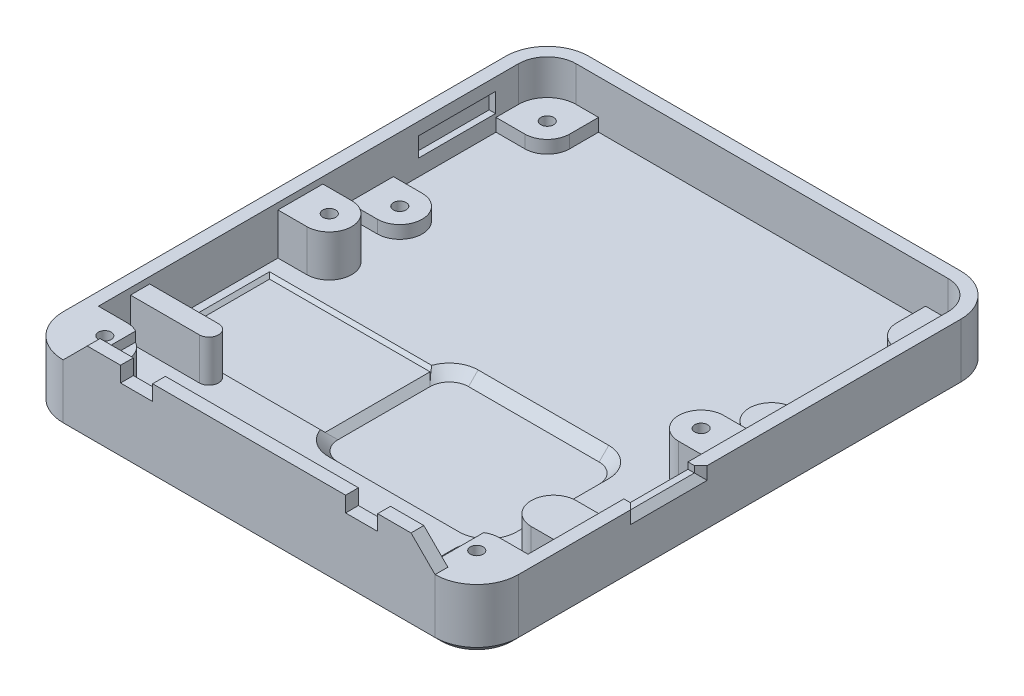
from build123d import *

# Parameters (mm, degrees)
BOSS_EXTRUDE1_DEPTH          = 9.5
BOSS_EXTRUDE2_DEPTH          = 2
CUT_EXTRUDE2_DEPTH           = 1.5
CHAMFER1_SIZE                = 1.5
BOSS_EXTRUDE3_DEPTH          = 8
BOSS_EXTRUDE4_DEPTH          = 3.5
BOSS_EXTRUDE5_START          = -2
BOSS_EXTRUDE5_DEPTH          = 2
BOSS_EXTRUDE6_DEPTH          = 7.5
CUT_EXTRUDE3_REACH           = 85.273
SKETCH11_W                   = 10
SKETCH11_H                   = 1.000174578
CHAMFER2_SIZE                = 1
CHAMFER4_SIZE                = 1
F_2_0_2_DIAMETER_HOLE1_D     = 2
F_2_0_2_DIAMETER_HOLE2_D     = 2
F_2_0_2_DIAMETER_HOLE3_D     = 2
F_2_0_2_DIAMETER_HOLE4_D     = 2
F_2_0_2_DIAMETER_HOLE5_D     = 2
F_2_0_2_DIAMETER_HOLE5_DEPTH = 6.5
F_2_0_2_DIAMETER_HOLE6_D     = 2
F_2_0_2_DIAMETER_HOLE6_DEPTH = 6.5
F_2_0_2_DIAMETER_HOLE7_D     = 2
F_2_0_2_DIAMETER_HOLE7_DEPTH = 3
F_2_0_2_DIAMETER_HOLE8_D     = 2
F_2_0_2_DIAMETER_HOLE8_DEPTH = 3
SKETCH34_W                   = 26.314778403
SKETCH34_H                   = 14.364291853
CUT_EXTRUDE5_DEPTH           = 0.5
CHAMFER5_SIZE                = 1.5
SKETCH12_W                   = 12
SKETCH12_H                   = 3
CUT_EXTRUDE6_DEPTH           = 1
SKETCH35_W                   = 54.374424004
SKETCH35_H                   = 8.57873693
CUT_EXTRUDE7_DEPTH           = 1.5
CUT_EXTRUDE8_DEPTH           = 0.4
CUT_EXTRUDE14_DEPTH          = 0.4


# Some blends are built 0.0001 mm under size
with BuildPart() as part:
    # Sketch2 → Boss-Extrude1 (new body)
    with BuildSketch(Plane(origin=(0, 0, 0), x_dir=(1, 0, 0), z_dir=(0, 1, 0))):
        with BuildLine():
            Line((-30.346153846, 41.446848386), (27.653846154, 41.446848386))
            ThreePointArc((27.653846154, 41.446848386), (32.250040232, 39.543042463), (34.153846154, 34.946848386))
            Line((34.153846154, 34.946848386), (34.153846154, -34.053151614))
            ThreePointArc((34.153846154, -34.053151614), (32.250040232, -38.649345692), (27.653846154, -40.553151614))
            Line((27.653846154, -40.553151614), (-30.346153846, -40.553151614))
            ThreePointArc((-30.346153846, -40.553151614), (-34.942347924, -38.649345692), (-36.846153846, -34.053151614))
            Line((-36.846153846, -34.053151614), (-36.846153846, 34.946848386))
            ThreePointArc((-36.846153846, 34.946848386), (-34.942347924, 39.543042463), (-30.346153846, 41.446848386))
        make_face()
        with BuildLine():
            Line((-30.346153846, 39.446848386), (27.653846154, 39.446848386))
            ThreePointArc((27.653846154, 39.446848386), (30.835826669, 38.128828901), (32.153846154, 34.946848386))
            Line((32.153846154, 34.946848386), (32.153846154, -34.053151614))
            ThreePointArc((32.153846154, -34.053151614), (30.835826669, -37.23513213), (27.653846154, -38.553151614))
            Line((27.653846154, -38.553151614), (-30.346153846, -38.553151614))
            ThreePointArc((-30.346153846, -38.553151614), (-33.528134361, -37.23513213), (-34.846153846, -34.053151614))
            Line((-34.846153846, -34.053151614), (-34.846153846, 34.946848386))
            ThreePointArc((-34.846153846, 34.946848386), (-33.528134361, 38.128828901), (-30.346153846, 39.446848386))
        make_face(mode=Mode.SUBTRACT)
    extrude(amount=BOSS_EXTRUDE1_DEPTH)

    # Sketch3 → Boss-Extrude2 (add)
    with BuildSketch(Plane(origin=(0, 0, 0), x_dir=(1, 0, 0), z_dir=(0, 1, 0))):
        with BuildLine():
            Line((-30.346153846, -38.553151614), (27.653846154, -38.553151614))
            ThreePointArc((27.653846154, -38.553151614), (30.835826669, -37.23513213), (32.153846154, -34.053151614))
            Line((32.153846154, -34.053151614), (32.153846154, 34.946848386))
            ThreePointArc((32.153846154, 34.946848386), (30.835826669, 38.128828901), (27.653846154, 39.446848386))
            Line((27.653846154, 39.446848386), (-30.346153846, 39.446848386))
            ThreePointArc((-30.346153846, 39.446848386), (-33.528134361, 38.128828901), (-34.846153846, 34.946848386))
            Line((-34.846153846, 34.946848386), (-34.846153846, -34.053151614))
            ThreePointArc((-34.846153846, -34.053151614), (-33.528134361, -37.23513213), (-30.346153846, -38.553151614))
        make_face()
    extrude(amount=BOSS_EXTRUDE2_DEPTH)

    # Sketch4 → Cut-Extrude2 (cut)
    with BuildSketch(Plane(origin=(0, 2, 0), x_dir=(1, 0, 0), z_dir=(0, 1, 0))):
        with BuildLine():
            Line((-4.123389118, -3.554786526), (16.244427307, -3.554786526))
            ThreePointArc((16.244427307, -3.554786526), (18.365747651, -4.433466182), (19.244427307, -6.554786526))
            Line((19.244427307, -6.554786526), (19.244427307, -20.919078379))
            ThreePointArc((19.244427307, -20.919078379), (18.365747651, -23.040398722), (16.244427307, -23.919078379))
            Line((16.244427307, -23.919078379), (-4.123389118, -23.919078379))
            ThreePointArc((-4.123389118, -23.919078379), (-6.244709462, -23.040398722), (-7.123389118, -20.919078379))
            Line((-7.123389118, -20.919078379), (-7.123389118, -6.554786526))
            ThreePointArc((-7.123389118, -6.554786526), (-6.244709462, -4.433466182), (-4.123389118, -3.554786526))
        make_face()
    extrude(amount=-CUT_EXTRUDE2_DEPTH, mode=Mode.SUBTRACT)

    # Chamfer1
    chamfer1_edges = [part.edges().sort_by_distance(p)[0] for p in [
        (6.060519095, 2, 23.919078379),
        (18.365747651, 2, 23.040398722),
        (-6.244709462, 2, 23.040398722),
        (19.244427307, 2, 13.736932452),
        (-7.123389118, 2, 13.736932452),
        (18.365747651, 2, 4.433466182),
        (-6.244709462, 2, 4.433466182),
        (6.060519095, 2, 3.554786526),
    ]]
    chamfer(chamfer1_edges, length=CHAMFER1_SIZE - 0.0001)  # a hair under: the kernel refuses the full size

    # Sketch5 → Boss-Extrude3 (add)
    with BuildSketch(Plane(origin=(0, 0.5, 0), x_dir=(1, 0, 0), z_dir=(0, 1, 0))):
        with BuildLine():
            Line((-30.346153846, 4.446848386), (-34.846153846, 4.446848386))
            Line((-34.846153846, 4.446848386), (-34.846153846, -2.553151614))
            Line((-34.846153846, -2.553151614), (-30.346153846, -2.553151614))
            ThreePointArc((-30.346153846, -2.553151614), (-26.846153846, 0.946848386), (-30.346153846, 4.446848386))
        make_face()
        with BuildLine():
            Line((27.653846154, 4.446848386), (32.153846154, 4.446848386))
            Line((32.153846154, 4.446848386), (32.153846154, -2.553151614))
            Line((32.153846154, -2.553151614), (27.653846154, -2.553151614))
            ThreePointArc((27.653846154, -2.553151614), (24.153846154, 0.946848386), (27.653846154, 4.446848386))
        make_face()
        with BuildLine():
            Line((32.153846154, -18.553151614), (32.153846154, -25.553151614))
            Line((32.153846154, -25.553151614), (27.653846154, -25.553151614))
            ThreePointArc((27.653846154, -25.553151614), (24.153846154, -22.053151614), (27.653846154, -18.553151614))
            Line((27.653846154, -18.553151614), (32.153846154, -18.553151614))
        make_face()
        with BuildLine():
            Line((-34.846153846, -25.553151614), (-24.109430948, -25.553151614))
            ThreePointArc((-24.109430948, -25.553151614), (-22.609430948, -24.053151614), (-24.109430948, -22.553151614))
            Line((-24.109430948, -22.553151614), (-34.846153846, -22.553151614))
            Line((-34.846153846, -22.553151614), (-34.846153846, -25.553151614))
        make_face()
    extrude(amount=BOSS_EXTRUDE3_DEPTH)

    # Sketch6 → Boss-Extrude4 (add)
    with BuildSketch(Plane(origin=(0, 0.5, 0), x_dir=(1, 0, 0), z_dir=(0, 1, 0))):
        with BuildLine():
            Line((-30.346153846, 15.446848386), (-34.846153846, 15.446848386))
            Line((-34.846153846, 15.446848386), (-34.846153846, 8.446848386))
            Line((-34.846153846, 8.446848386), (-30.346153846, 8.446848386))
            ThreePointArc((-30.346153846, 8.446848386), (-26.846153846, 11.946848386), (-30.346153846, 15.446848386))
        make_face()
        with BuildLine():
            Line((-26.846153846, 34.946848386), (-26.846153846, 39.446848386))
            Line((-26.846153846, 39.446848386), (-30.346153846, 39.446848386))
            ThreePointArc((-30.346153846, 39.446848386), (-33.528134361, 38.128828901), (-34.846153846, 34.946848386))
            Line((-34.846153846, 34.946848386), (-34.846153846, 31.446848386))
            Line((-34.846153846, 31.446848386), (-30.346153846, 31.446848386))
            ThreePointArc((-30.346153846, 31.446848386), (-27.871280112, 32.471974652), (-26.846153846, 34.946848386))
        make_face()
        with BuildLine():
            Line((24.153846154, 34.946848386), (24.153846154, 39.446848386))
            Line((24.153846154, 39.446848386), (27.653846154, 39.446848386))
            ThreePointArc((27.653846154, 39.446848386), (30.835826669, 38.128828901), (32.153846154, 34.946848386))
            Line((32.153846154, 34.946848386), (32.153846154, 31.446848386))
            Line((32.153846154, 31.446848386), (27.653846154, 31.446848386))
            ThreePointArc((27.653846154, 31.446848386), (25.17897242, 32.471974652), (24.153846154, 34.946848386))
        make_face()
        with BuildLine():
            Line((27.653846154, 15.446848386), (32.153846154, 15.446848386))
            Line((32.153846154, 15.446848386), (32.153846154, 8.446848386))
            Line((32.153846154, 8.446848386), (27.653846154, 8.446848386))
            ThreePointArc((27.653846154, 8.446848386), (24.153846154, 11.946848386), (27.653846154, 15.446848386))
        make_face()
    extrude(amount=BOSS_EXTRUDE4_DEPTH)

    # Sketch7 → Boss-Extrude5 (add)
    with BuildSketch(Plane.XY.offset(40.553151614).offset(BOSS_EXTRUDE5_START)):
        Polygon((27.653846154, 9.5), (-30.346153846, 9.5), (-26.595001855, 13.251151991), (-21.39693017, 13.251151991), (-21.39693017, 10.851151991), (-16.39693017, 10.851151991), (-16.39693017, 13.251151991), (13.704622477, 13.251151991), (13.704622477, 10.851151991), (18.704622477, 10.851151991), (18.704622477, 13.251151991), (23.902694163, 13.251151991), align=None)
    extrude(amount=BOSS_EXTRUDE5_DEPTH)

    # Sketch10 → Boss-Extrude6 (add)
    with BuildSketch(Plane(origin=(0, 2, 0), x_dir=(1, 0, 0), z_dir=(0, 1, 0))):
        with BuildLine():
            Line((-30.346153846, -30.553151614), (-34.846153846, -30.553151614))
            Line((-34.846153846, -30.553151614), (-34.846153846, -34.053151614))
            ThreePointArc((-34.846153846, -34.053151614), (-33.528134361, -37.23513213), (-30.346153846, -38.553151614))
            Line((-30.346153846, -38.553151614), (-26.846153846, -38.553151614))
            Line((-26.846153846, -38.553151614), (-26.846153846, -34.053151614))
            ThreePointArc((-26.846153846, -34.053151614), (-27.871280112, -31.57827788), (-30.346153846, -30.553151614))
        make_face()
        with BuildLine():
            Line((27.653846154, -30.553151614), (32.153846154, -30.553151614))
            Line((32.153846154, -30.553151614), (32.153846154, -34.053151614))
            ThreePointArc((32.153846154, -34.053151614), (30.835826669, -37.23513213), (27.653846154, -38.553151614))
            Line((27.653846154, -38.553151614), (24.153846154, -38.553151614))
            Line((24.153846154, -38.553151614), (24.153846154, -34.053151614))
            ThreePointArc((24.153846154, -34.053151614), (25.17897242, -31.57827788), (27.653846154, -30.553151614))
        make_face()
    extrude(amount=BOSS_EXTRUDE6_DEPTH)

    # Sketch11 → Cut-Extrude3 (cut, up to next)
    with BuildSketch(Plane(origin=(34.153846154, 0, 0), x_dir=(0, 0, -1), z_dir=(1, 0, 0)), mode=Mode.PRIVATE) as cut_extrude3_sk1:
        with Locations((-10.60615222, 9.00123928)):
            Rectangle(SKETCH11_W, SKETCH11_H)
    cut_extrude3_tool1 = extrude(cut_extrude3_sk1.sketch, amount=-CUT_EXTRUDE3_REACH, mode=Mode.PRIVATE) & part.part
    add(cut_extrude3_tool1.solids().sort_by_distance((34.153846, 9.001239, 10.606152))[0], mode=Mode.SUBTRACT)

    # Chamfer2
    chamfer2_edges = [part.edges().sort_by_distance(p)[0] for p in [
        (34.153846154, 9.000575996, 15.60615222),
        (34.153846154, 8.501151991, 10.60615222),
        (34.153846154, 9.000575996, 5.60615222),
    ]]
    chamfer(chamfer2_edges, length=CHAMFER2_SIZE)

    # Chamfer4
    chamfer4_edges = [part.edges().sort_by_distance(p)[0] for p in [
        (-36.846153846, 0, -0.446848386),
        (-34.942347924, 0, -39.543042463),
        (-1.346153846, 0, -41.446848386),
        (32.250040232, 0, -39.543042463),
        (34.153846154, 0, -0.446848386),
        (32.250040232, 0, 38.649345692),
        (-1.346153846, 0, 40.553151614),
        (-34.942347924, 0, 38.649345692),
    ]]
    chamfer(chamfer4_edges, length=CHAMFER4_SIZE)

    # Ø2.0 (2) Diameter Hole1 (through all)
    with Locations(Plane(origin=(0, 0, 0), x_dir=(-1, 0, 0), z_dir=(0, -1, 0))):
        with Locations((30.346153846, -34.053151614)):
            Hole(F_2_0_2_DIAMETER_HOLE1_D / 2)

    # Ø2.0 (2) Diameter Hole2 (through all)
    with Locations(Plane(origin=(0, 0, 0), x_dir=(-1, 0, 0), z_dir=(0, -1, 0))):
        with Locations((-27.653846154, -34.053151614)):
            Hole(F_2_0_2_DIAMETER_HOLE2_D / 2)

    # Ø2.0 (2) Diameter Hole3 (through all)
    with Locations(Plane(origin=(0, 0, 0), x_dir=(-1, 0, 0), z_dir=(0, -1, 0))):
        with Locations((30.346153846, 34.946848386)):
            Hole(F_2_0_2_DIAMETER_HOLE3_D / 2)

    # Ø2.0 (2) Diameter Hole4 (through all)
    with Locations(Plane(origin=(0, 0, 0), x_dir=(-1, 0, 0), z_dir=(0, -1, 0))):
        with Locations((-27.653846154, 34.946848386)):
            Hole(F_2_0_2_DIAMETER_HOLE4_D / 2)

    # Ø2.0 (2) Diameter Hole5
    with Locations(Plane(origin=(0, 8.5, 0), x_dir=(1, 0, 0), z_dir=(0, 1, 0))):
        with Locations((-30.346153846, 0.946848386)):
            Hole(F_2_0_2_DIAMETER_HOLE5_D / 2, depth=F_2_0_2_DIAMETER_HOLE5_DEPTH)

    # Ø2.0 (2) Diameter Hole6
    with Locations(Plane(origin=(0, 8.5, 0), x_dir=(1, 0, 0), z_dir=(0, 1, 0))):
        with Locations((27.653846154, 0.946848386)):
            Hole(F_2_0_2_DIAMETER_HOLE6_D / 2, depth=F_2_0_2_DIAMETER_HOLE6_DEPTH)

    # Ø2.0 (2) Diameter Hole7
    with Locations(Plane(origin=(0, 4, 0), x_dir=(1, 0, 0), z_dir=(0, 1, 0))):
        with Locations((-30.346153846, 11.946848386)):
            Hole(F_2_0_2_DIAMETER_HOLE7_D / 2, depth=F_2_0_2_DIAMETER_HOLE7_DEPTH)

    # Ø2.0 (2) Diameter Hole8
    with Locations(Plane(origin=(0, 4, 0), x_dir=(1, 0, 0), z_dir=(0, 1, 0))):
        with Locations((27.653846154, 11.946848386)):
            Hole(F_2_0_2_DIAMETER_HOLE8_D / 2, depth=F_2_0_2_DIAMETER_HOLE8_DEPTH)

    # Sketch34 → Cut-Extrude5 (cut)
    with BuildSketch(Plane(origin=(0, 2, 0), x_dir=(1, 0, 0), z_dir=(0, 1, 0))):
        with Locations((-19.000372269, -13.736932453)):
            Rectangle(SKETCH34_W, SKETCH34_H)
    extrude(amount=-CUT_EXTRUDE5_DEPTH, mode=Mode.SUBTRACT)

    # Chamfer5
    # the kernel refuses this chamfer: 1.5 mm, written as the material it takes off along each edge
    with BuildSketch(Plane(origin=(-32.15776147, 2, 20.919078379), x_dir=(0, 0, 1), z_dir=(1, 0, 0))) as chamfer5_piece_1_section:
        Polygon((CHAMFER5_SIZE, 0), (0, CHAMFER5_SIZE), (0, 0), align=None)
    chamfer5_piece_1 = extrude(amount=27.391996834, mode=Mode.PRIVATE)
    chamfer5_piece_1 = split(chamfer5_piece_1, bisect_by=Plane(origin=(-32.15776147, 1.5, 20.919078379), z_dir=(0, 1, 0)), keep=Keep.TOP, mode=Mode.PRIVATE)
    add(chamfer5_piece_1, mode=Mode.SUBTRACT)
    with BuildSketch(Plane(origin=(-36.015285952, 2, 20.919078379), x_dir=(0, 0, 1), z_dir=(1, 0, 0))) as chamfer5_piece_2_section:
        Polygon((CHAMFER5_SIZE, 0), (0, CHAMFER5_SIZE), (0, 0), align=None)
    chamfer5_piece_2 = extrude(amount=31.249521316, mode=Mode.PRIVATE)
    chamfer5_piece_2 = split(chamfer5_piece_2, bisect_by=Plane(origin=(-22.319287535, 15.695998417, 20.919078379), z_dir=(0.7071067811865475, 0.7071067811865476, 0)), keep=Keep.TOP, mode=Mode.PRIVATE)
    add(chamfer5_piece_2, mode=Mode.SUBTRACT)
    with BuildSketch(Plane(origin=(-32.15776147, 2, 6.554786526), x_dir=(-1, 0, 0), z_dir=(0, 0, 1))) as chamfer5_piece_3_section:
        Polygon((CHAMFER5_SIZE, 0), (0, CHAMFER5_SIZE), (0, 0), align=None)
    chamfer5_piece_3 = extrude(amount=14.364291853, mode=Mode.PRIVATE)
    chamfer5_piece_3 = split(chamfer5_piece_3, bisect_by=Plane(origin=(-32.15776147, 1.5, 6.554786526), z_dir=(0, 1, 0)), keep=Keep.TOP, mode=Mode.PRIVATE)
    add(chamfer5_piece_3, mode=Mode.SUBTRACT)
    with BuildSketch(Plane(origin=(-4.765764636, 2, 6.554786526), x_dir=(0, 0, -1), z_dir=(-1, 0, 0))) as chamfer5_piece_4_section:
        Polygon((CHAMFER5_SIZE, 0), (0, CHAMFER5_SIZE), (0, 0), align=None)
    chamfer5_piece_4 = extrude(amount=27.391996834, mode=Mode.PRIVATE)
    chamfer5_piece_4 = split(chamfer5_piece_4, bisect_by=Plane(origin=(-4.765764636, 1.5, 6.554786526), z_dir=(0, 1, 0)), keep=Keep.TOP, mode=Mode.PRIVATE)
    add(chamfer5_piece_4, mode=Mode.SUBTRACT)
    with BuildSketch(Plane(origin=(-4.765764636, 2, 6.554786526), x_dir=(0, 0, -1), z_dir=(-1, 0, 0))) as chamfer5_piece_5_section:
        Polygon((CHAMFER5_SIZE, 0), (0, CHAMFER5_SIZE), (0, 0), align=None)
    chamfer5_piece_5 = extrude(amount=31.249521316, mode=Mode.PRIVATE)
    chamfer5_piece_5 = split(chamfer5_piece_5, bisect_by=Plane(origin=(-6.694526877, 0.071237759, 6.554786526), z_dir=(0.7071067811865475, 0.7071067811865476, 0)), keep=Keep.TOP, mode=Mode.PRIVATE)
    add(chamfer5_piece_5, mode=Mode.SUBTRACT)
    with BuildSketch(Plane(origin=(-32.15776147, 2, 6.554786526), x_dir=(-1, 0, 0), z_dir=(0, 0, 1))) as chamfer5_piece_6a_section:
        Polygon((CHAMFER5_SIZE, 0), (0, CHAMFER5_SIZE), (0, 0), align=None)
    chamfer5_piece_6a = extrude(amount=18.221816335, mode=Mode.PRIVATE)
    chamfer5_piece_6a = split(chamfer5_piece_6a, bisect_by=Plane(origin=(-32.15776147, 2, 22.553151614), z_dir=(0, 0, -1)), keep=Keep.TOP, mode=Mode.PRIVATE)
    chamfer5_piece_6a = split(chamfer5_piece_6a, bisect_by=Plane(origin=(-32.15776147, 2, 20.919078379), z_dir=(0, 0, 1)), keep=Keep.TOP, mode=Mode.PRIVATE)
    chamfer5_piece_6a = split(chamfer5_piece_6a, bisect_by=Plane(origin=(-32.15776147, 1.5, 6.554786526), z_dir=(0, 1, 0)), keep=Keep.TOP, mode=Mode.PRIVATE)
    with BuildSketch(Plane(origin=(-36.015285952, 2, 20.919078379), x_dir=(0, 0, 1), z_dir=(1, 0, 0))) as chamfer5_piece_6b_section:
        Polygon((CHAMFER5_SIZE, 0), (0, CHAMFER5_SIZE), (0, 0), align=None)
    chamfer5_piece_6b = extrude(amount=31.249521316, mode=Mode.PRIVATE)
    chamfer5_piece_6b = split(chamfer5_piece_6b, bisect_by=Plane(origin=(-34.846153846, 2, 20.919078379), z_dir=(1, 0, 0)), keep=Keep.TOP, mode=Mode.PRIVATE)
    chamfer5_piece_6b = split(chamfer5_piece_6b, bisect_by=Plane(origin=(-32.15776147, 2, 20.919078379), z_dir=(-1, 0, 0)), keep=Keep.TOP, mode=Mode.PRIVATE)
    chamfer5_piece_6b = split(chamfer5_piece_6b, bisect_by=Plane(origin=(-36.015285952, 1.5, 20.919078379), z_dir=(0, 1, 0)), keep=Keep.TOP, mode=Mode.PRIVATE)
    chamfer5_piece_6 = chamfer5_piece_6a & chamfer5_piece_6b
    add(chamfer5_piece_6, mode=Mode.SUBTRACT)
    with BuildSketch(Plane(origin=(-4.765764636, 2, 6.554786526), x_dir=(0, 0, -1), z_dir=(-1, 0, 0))) as chamfer5_piece_7a_section:
        Polygon((CHAMFER5_SIZE, 0), (0, CHAMFER5_SIZE), (0, 0), align=None)
    chamfer5_piece_7a = extrude(amount=31.249521316, mode=Mode.PRIVATE)
    chamfer5_piece_7a = split(chamfer5_piece_7a, bisect_by=Plane(origin=(-34.846153846, 2, 6.554786526), z_dir=(1, 0, 0)), keep=Keep.TOP, mode=Mode.PRIVATE)
    chamfer5_piece_7a = split(chamfer5_piece_7a, bisect_by=Plane(origin=(-32.15776147, 2, 6.554786526), z_dir=(-1, 0, 0)), keep=Keep.TOP, mode=Mode.PRIVATE)
    chamfer5_piece_7a = split(chamfer5_piece_7a, bisect_by=Plane(origin=(-4.765764636, 1.5, 6.554786526), z_dir=(0, 1, 0)), keep=Keep.TOP, mode=Mode.PRIVATE)
    with BuildSketch(Plane(origin=(-32.15776147, 2, 2.697262044), x_dir=(-1, 0, 0), z_dir=(0, 0, 1))) as chamfer5_piece_7b_section:
        Polygon((CHAMFER5_SIZE, 0), (0, CHAMFER5_SIZE), (0, 0), align=None)
    chamfer5_piece_7b = extrude(amount=18.221816335, mode=Mode.PRIVATE)
    chamfer5_piece_7b = split(chamfer5_piece_7b, bisect_by=Plane(origin=(-32.15776147, 2, 6.554786526), z_dir=(0, 0, -1)), keep=Keep.TOP, mode=Mode.PRIVATE)
    chamfer5_piece_7b = split(chamfer5_piece_7b, bisect_by=Plane(origin=(-32.15776147, 1.5, 2.697262044), z_dir=(0, 1, 0)), keep=Keep.TOP, mode=Mode.PRIVATE)
    chamfer5_piece_7 = chamfer5_piece_7a & chamfer5_piece_7b
    add(chamfer5_piece_7, mode=Mode.SUBTRACT)

    # Sketch12 → Cut-Extrude6 (cut)
    with BuildSketch(Plane.ZY.offset(34.846153846)):
        with Locations((-25.387777412, 6.045172425)):
            Rectangle(SKETCH12_W, SKETCH12_H)
    extrude(amount=CUT_EXTRUDE6_DEPTH, mode=Mode.SUBTRACT)

    # Sketch35 → Cut-Extrude7 (cut)
    with BuildSketch(Plane(origin=(0, 9.5, 0), x_dir=(1, 0, 0), z_dir=(0, 1, 0))):
        with Locations((-1.408941844, -34.263783149)):
            Rectangle(SKETCH35_W, SKETCH35_H)
    extrude(amount=-CUT_EXTRUDE7_DEPTH, mode=Mode.SUBTRACT)

    # Sketch36 → Cut-Extrude8 (cut)
    with BuildSketch(Plane.XZ):
        with BuildLine():
            Line((-5.64112521, -4.436061222), (-6.578756774, -2.998727417))
            ThreePointArc((-6.578756774, -2.998727417), (-10.903330816, -11.003318336), (-6.54508742, -18.989627304))
            Line((-6.54508742, -18.989627304), (-5.613516848, -17.548357834))
            ThreePointArc((-5.613516848, -17.548357834), (-9.187210669, -10.99970499), (-5.64112521, -4.436061222))
        make_face()
        with BuildLine():
            Line((2.873258501, -4.418133913), (3.804829073, -2.976864443))
            ThreePointArc((3.804829073, -2.976864443), (8.163072469, -10.963173411), (3.838498427, -18.96776433))
            Line((3.838498427, -18.96776433), (2.900866863, -17.530430525))
            ThreePointArc((2.900866863, -17.530430525), (6.446952322, -10.966786757), (2.873258501, -4.418133913))
        make_face()
        with BuildLine():
            Line((-14.741095194, -31.669993272), (-15.58410549, -32.974247656))
            ThreePointArc((-15.58410549, -32.974247656), (-27.554823987, -11.03837859), (-15.676584573, 10.947705223))
            Line((-15.676584573, 10.947705223), (-14.828089477, 9.647012358))
            ThreePointArc((-14.828089477, 9.647012358), (-26.001847759, -11.035108749), (-14.741095194, -31.669993272))
        make_face()
        with BuildLine():
            Line((-9.464008546, -23.505604976), (-10.358454308, -24.889437193))
            ThreePointArc((-10.358454308, -24.889437193), (-17.928236863, -11.018109501), (-10.41693422, 2.8849719))
            Line((-10.41693422, 2.8849719), (-9.516669007, 1.504918504))
            ThreePointArc((-9.516669007, 1.504918504), (-16.280507277, -11.014640154), (-9.464008546, -23.505604976))
        make_face()
        with BuildLine():
            Line((12.000836847, 9.703501525), (12.843847143, 11.007755909))
            ThreePointArc((12.843847143, 11.007755909), (24.81456564, -10.928113157), (12.936326227, -32.91419697))
            Line((12.936326227, -32.91419697), (12.087831131, -31.613504105))
            ThreePointArc((12.087831131, -31.613504105), (23.261589412, -10.931382998), (12.000836847, 9.703501525))
        make_face()
        with BuildLine():
            Line((6.723750199, 1.539113229), (7.618195962, 2.922945446))
            ThreePointArc((7.618195962, 2.922945446), (15.187978517, -10.948382245), (7.676675873, -24.851463646))
            Line((7.676675873, -24.851463646), (6.77641066, -23.471410251))
            ThreePointArc((6.77641066, -23.471410251), (13.54024893, -10.951851593), (6.723750199, 1.539113229))
        make_face()
        Polygon((-3.590327229, -40.446848386), (-2.243823199, -13.32441007), (-0.192007535, -13.32441007), (0.898019537, -40.446848386), align=None)
    extrude(amount=-CUT_EXTRUDE8_DEPTH, mode=Mode.SUBTRACT)

    # Sketch37 → Cut-Extrude14 (cut)
    with BuildSketch(Plane(origin=(0, 0, 0), x_dir=(1, 0, 0), z_dir=(0, 1, 0))):
        Polygon((-1.900835804, 5.713351067), (12.321113049, -8.077629639), (16.140881841, -4.138493072), (3.460872975, 11.242613246), (9.800877408, 20.366268067), (15.114890551, 16.246191595), (17.804077, 19.01941512), (12.774020194, 24.200983259), (13.773097336, 25.489578046), (13.486166718, 25.712041945), (13.259612203, 25.995753803), (11.985472751, 24.978305861), (6.732325521, 29.933562064), (3.997939541, 27.204894661), (8.193775029, 21.950493612), (-0.838050997, 15.480342751), (-16.399358991, 27.938542859), (-20.283330009, 24.06269461), (-6.289878748, 10.039916717), (-8.413362715, 7.387512057), (-9.902597392, 5.133732631), (-10.75711697, 3.486297202), (-10.30907994, 2.860872447), (-10.808273898, 1.898472246), (-11.08332896, 1.032139713), (-11.079875273, 0.791256733), (-10.838967536, 0.791256733), (-9.976667261, 1.07870339), (-9.021522477, 1.59164315), (-8.389738875, 1.152618339), (-6.754723259, 2.030667962), (-4.522525324, 3.552060087), align=None)
    extrude(amount=CUT_EXTRUDE14_DEPTH, mode=Mode.SUBTRACT)


solid = part.part
